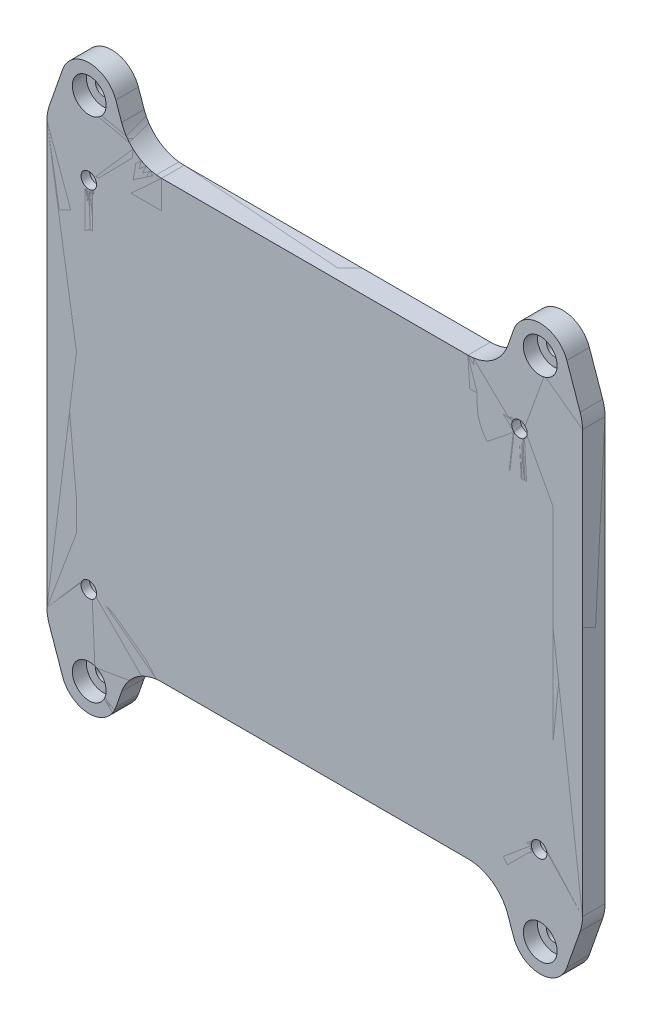
from build123d import *

# Parameters (mm, degrees)
PARTOFPLATESUPPORTINGCHARGER_SKETCH_W         = 190
PARTOFPLATESUPPORTINGCHARGER_SKETCH_H         = 154.72
PARTOFPLATESUPPORTINGCHARGER_EXTRUDE_DEPTH    = 8
PLATETOWALLMOUNTHOLETABSEED_EXTRUDE_DEPTH     = 8
MIRROR2_COPY_1_DEPTH                          = 8
FILLET2_R                                     = 15
PLATETOWALLMOUNTHOLES_SKETCH_R                = 2.75
PLATETOWALLMOUNTHOLESCLEARANCEHOLES_CUT_DEPTH = 139.162947276
PLATETOWALLMOUNTHOLESCOUNTERBORE_CUT_START    = 8
PLATETOWALLMOUNTHOLESCOUNTERBORE_SKETCH_R     = 6
PLATETOWALLMOUNTHOLESCOUNTERBORE_CUT_DEPTH    = 5
CHARGERTOPLATEHOLESCLEARANCEHOLES_SKETCH_R    = 2.75
CHARGERTOPLATEHOLES_CUT_DEPTH                 = 139.162947276
CHARGERTOPLATEHOLESCOUNTERBORES_SKETCH_R      = 6
CHARGERTOPLATEHOLESCOUNTERBORE_CUT_DEPTH      = 5
UNTHINNED_BODY_OUTLINE_R                      = 6
UNTHINNED_BODY_DEPTH                          = 8
UNTHINNED_BODY_2_OUTLINE_R                    = 6
UNTHINNED_BODY_2_OUTLINE_R_2                  = 2.75
UNTHINNED_BODY_2_DEPTH                        = 3
UNTHINNED_BODY_START                          = 5
UNTHINNED_BODY_3_OUTLINE_R                    = 6
UNTHINNED_BODY_3_OUTLINE_R_2                  = 2.75
UNTHINNED_BODY_3_DEPTH                        = 3
GUARANTEEDSOLIDREGIONS2AROUNDCHARGERTOPL_W    = 37.3625
GUARANTEEDSOLIDREGIONS2AROUNDCHARGERTOPL_H    = 28.505
BOSS_EXTRUDE5_DEPTH                           = 8
GUARANTEEDSOLIDREGIONS2AROUNDCHARGERTOPL_W_2  = 29.8525
BOSS_EXTRUDE5_2_DEPTH                         = 8
GUARANTEEDSOLIDREGIONS2AROUNDCHARGERTOPL_H_2  = 30.5
BOSS_EXTRUDE5_3_DEPTH                         = 8
GUARANTEEDSOLIDREGIONS2AROUNDCHARGERTOPL_W_3  = 30.3925
BOSS_EXTRUDE5_4_DEPTH                         = 8
CUT_EXTRUDE3_DEPTH                            = 8
NAIVETHINNABLEREGION_SKETCH_W                 = 169.09
NAIVETHINNABLEREGION_SKETCH_H                 = 134.72
NAIVETHINNABLEMASK_EXTRUDE_DEPTH              = 8
GUARANTEEDSOLIDREGIONS1AROUNDCHARGERTOPL_R    = 15
THINNABLEMASK_EXTRUDE_DEPTH                   = 8
THINNABLEMASKCOPY_DEPTH                       = 8
THINNINGPATTERNFODDER_SKETCH_R                = 150
THINNINGPATTERNFODDER_EXTRUDE_DEPTH           = 8
THINNINGPATTERN_DEPTH                         = 8
MOUNT_PLATE_EMPTY_INTERIOR_COPY_OUTLINE_R     = 6
MOUNT_PLATE_EMPTY_INTERIOR_COPY_DEPTH         = 8
MOUNT_PLATE_EMPTY_INTERIOR_COPY_2_OUTLIN_R    = 6
MOUNT_PLATE_EMPTY_INTERIOR_COPY_2_OUTLIN_R_2  = 2.75
MOUNT_PLATE_EMPTY_INTERIOR_COPY_2_DEPTH       = 3
MOUNT_PLATE_EMPTY_INTERIOR_COPY_START         = 5
MOUNT_PLATE_EMPTY_INTERIOR_COPY_3_OUTLIN_R    = 6
MOUNT_PLATE_EMPTY_INTERIOR_COPY_3_OUTLIN_R_2  = 2.75
MOUNT_PLATE_EMPTY_INTERIOR_COPY_3_DEPTH       = 3


# Read off the part's stored shape, not the designer's step: unthinned_body, thinnableMaskCopy, thinningPattern, mount_plate_empty_interior_copy
with BuildPart() as part:
    # partOfPlateSupportingCharger_sketch → partOfPlateSupportingCharger_extrude (new body)
    with BuildSketch(Plane.XY):
        Rectangle(PARTOFPLATESUPPORTINGCHARGER_SKETCH_W, PARTOFPLATESUPPORTINGCHARGER_SKETCH_H)
    extrude(amount=PARTOFPLATESUPPORTINGCHARGER_EXTRUDE_DEPTH)

    # plateToWallMountHoleTabSeed_sketch → plateToWallMountHoleTabSeed_extrude (add)
    with BuildSketch(Plane.XY):
        with BuildLine():
            Line((-89.442052821, 93.293575341), (-95, 77.36))
            Line((-95, 77.36), (-65, 77.36))
            Line((-65, 77.36), (-70.557947179, 93.293575341))
            ThreePointArc((-70.557947179, 93.293575341), (-80, 100), (-89.442052821, 93.293575341))
        make_face()
    platetowallmountholetabseed_extrude = extrude(amount=PLATETOWALLMOUNTHOLETABSEED_EXTRUDE_DEPTH)

    # Mirror1: plateToWallMountHoleTabSeed_extrude across plane
    add(platetowallmountholetabseed_extrude.mirror(Plane(origin=(0, 0, 0), x_dir=(0, 0, 1), z_dir=(1, 0, 0))))

    # Mirror2: plateToWallMountHoleTabSeed_extrude across plane
    add(platetowallmountholetabseed_extrude.mirror(Plane.ZX))

    # Mirror2 copy 1 sketch → Mirror2 copy 1 (add)
    with BuildSketch(Plane(origin=(0, 0, 0), x_dir=(-1, 0, 0), z_dir=(0, 0, 1))):
        with BuildLine():
            Line((-89.442052821, 93.293575341), (-95, 77.36))
            Line((-95, 77.36), (-65, 77.36))
            Line((-65, 77.36), (-70.557947179, 93.293575341))
            ThreePointArc((-70.557947179, 93.293575341), (-80, 100), (-89.442052821, 93.293575341))
        make_face()
    extrude(amount=MIRROR2_COPY_1_DEPTH)

    # Fillet2
    fillet2_edges = [part.edges().sort_by_distance(p)[0] for p in [
        (-65, 77.36, 4),
        (-95, 77.36, 4),
        (95, 77.36, 4),
        (95, -77.36, 4),
        (65, 77.36, 4),
        (-95, -77.36, 4),
        (65, -77.36, 4),
        (-65, -77.36, 4),
    ]]
    fillet(fillet2_edges, radius=FILLET2_R)

    # plateToWallMountHoles_sketch → plateToWallMountHolesClearanceHoles_cut (cut, through all)
    with BuildSketch(Plane.XY):
        with Locations((-80, 90)):
            Circle(PLATETOWALLMOUNTHOLES_SKETCH_R)
        with Locations((80, 90)):
            Circle(PLATETOWALLMOUNTHOLES_SKETCH_R)
        with Locations((80, -90)):
            Circle(PLATETOWALLMOUNTHOLES_SKETCH_R)
        with Locations((-80, -90)):
            Circle(PLATETOWALLMOUNTHOLES_SKETCH_R)
    extrude(amount=PLATETOWALLMOUNTHOLESCLEARANCEHOLES_CUT_DEPTH, mode=Mode.SUBTRACT)

    # plateToWallMountHolesCounterbore_sketch → plateToWallMountHolesCounterBore_cut (cut)
    with BuildSketch(Plane.XY.offset(PLATETOWALLMOUNTHOLESCOUNTERBORE_CUT_START)):
        with Locations((-80, 90)):
            Circle(PLATETOWALLMOUNTHOLESCOUNTERBORE_SKETCH_R)
        with Locations((80, 90)):
            Circle(PLATETOWALLMOUNTHOLESCOUNTERBORE_SKETCH_R)
        with Locations((80, -90)):
            Circle(PLATETOWALLMOUNTHOLESCOUNTERBORE_SKETCH_R)
        with Locations((-80, -90)):
            Circle(PLATETOWALLMOUNTHOLESCOUNTERBORE_SKETCH_R)
    extrude(amount=-PLATETOWALLMOUNTHOLESCOUNTERBORE_CUT_DEPTH, mode=Mode.SUBTRACT)

    # chargerToPlateHolesClearanceHoles_sketch → chargerToPlateHoles_cut (cut, through all)
    with BuildSketch(Plane.XY):
        with Locations((-80.1475, 63.855)):
            Circle(CHARGERTOPLATEHOLESCLEARANCEHOLES_SKETCH_R)
        with Locations((72.6375, 63.855)):
            Circle(CHARGERTOPLATEHOLESCLEARANCEHOLES_SKETCH_R)
        with Locations((-80.1475, -61.86)):
            Circle(CHARGERTOPLATEHOLESCLEARANCEHOLES_SKETCH_R)
        with Locations((79.6075, -61.86)):
            Circle(CHARGERTOPLATEHOLESCLEARANCEHOLES_SKETCH_R)
    extrude(amount=CHARGERTOPLATEHOLES_CUT_DEPTH, mode=Mode.SUBTRACT)

    # chargerToPlateHolesCounterbores_sketch → chargerToPlateHolesCounterbore_cut (cut)
    with BuildSketch(Plane.XY):
        with Locations((-80.1475, 63.855)):
            Circle(CHARGERTOPLATEHOLESCOUNTERBORES_SKETCH_R)
        with Locations((72.6375, 63.855)):
            Circle(CHARGERTOPLATEHOLESCOUNTERBORES_SKETCH_R)
        with Locations((-80.1475, -61.86)):
            Circle(CHARGERTOPLATEHOLESCOUNTERBORES_SKETCH_R)
        with Locations((79.6075, -61.86)):
            Circle(CHARGERTOPLATEHOLESCOUNTERBORES_SKETCH_R)
    extrude(amount=CHARGERTOPLATEHOLESCOUNTERBORE_CUT_DEPTH, mode=Mode.SUBTRACT)


with BuildPart() as body_2:
    # unthinned_body outline → unthinned_body (new body)
    with BuildSketch(Plane.XY):
        with BuildLine():
            ThreePointArc((-68.509000951, -87.419636988), (-63.031960944, -80.130824942), (-54.34592172, -77.36))
            Line((-54.34592172, -77.36), (54.34592172, -77.36))
            ThreePointArc((54.34592172, -77.36), (63.031960944, -80.130824942), (68.509000951, -87.419636988))
            Line((68.509000951, -87.419636988), (70.557947179, -93.293575341))
            ThreePointArc((70.557947179, -93.293575341), (80, -100), (89.442052821, -93.293575341))
            Line((89.442052821, -93.293575341), (94.163079231, -79.759292345))
            ThreePointArc((94.163079231, -79.759292345), (94.789289849, -77.324304708), (95, -74.818929334))
            Line((95, -74.818929334), (95, 74.818929334))
            ThreePointArc((95, 74.818929334), (94.789289849, 77.324304708), (94.163079231, 79.759292345))
            Line((94.163079231, 79.759292345), (89.442052821, 93.293575341))
            ThreePointArc((89.442052821, 93.293575341), (80, 100), (70.557947179, 93.293575341))
            Line((70.557947179, 93.293575341), (68.509000951, 87.419636988))
            ThreePointArc((68.509000951, 87.419636988), (63.031960944, 80.130824942), (54.34592172, 77.36))
            Line((54.34592172, 77.36), (-54.345921719, 77.36))
            ThreePointArc((-54.345921719, 77.36), (-63.031960944, 80.130824942), (-68.509000951, 87.419636988))
            Line((-68.509000951, 87.419636988), (-70.557947179, 93.293575341))
            ThreePointArc((-70.557947179, 93.293575341), (-80, 100), (-89.442052821, 93.293575341))
            Line((-89.442052821, 93.293575341), (-94.163079231, 79.759292345))
            ThreePointArc((-94.163079231, 79.759292345), (-94.789289849, 77.324304707), (-95, 74.818929333))
            Line((-95, 74.818929333), (-95, -74.818929333))
            ThreePointArc((-95, -74.818929333), (-94.789289849, -77.324304707), (-94.163079231, -79.759292345))
            Line((-94.163079231, -79.759292345), (-89.442052821, -93.293575341))
            ThreePointArc((-89.442052821, -93.293575341), (-80, -100), (-70.557947179, -93.293575341))
            Line((-70.557947179, -93.293575341), (-68.509000951, -87.419636988))
        make_face()
        with Locations((-80, -90)):
            Circle(UNTHINNED_BODY_OUTLINE_R, mode=Mode.SUBTRACT)
        with Locations((-80.1475, -61.86)):
            Circle(UNTHINNED_BODY_OUTLINE_R, mode=Mode.SUBTRACT)
        with Locations((80, -90)):
            Circle(UNTHINNED_BODY_OUTLINE_R, mode=Mode.SUBTRACT)
        with Locations((79.6075, -61.86)):
            Circle(UNTHINNED_BODY_OUTLINE_R, mode=Mode.SUBTRACT)
        with Locations((-80.1475, 63.855)):
            Circle(UNTHINNED_BODY_OUTLINE_R, mode=Mode.SUBTRACT)
        with Locations((-80, 90)):
            Circle(UNTHINNED_BODY_OUTLINE_R, mode=Mode.SUBTRACT)
        with Locations((72.6375, 63.855)):
            Circle(UNTHINNED_BODY_OUTLINE_R, mode=Mode.SUBTRACT)
        with Locations((80, 90)):
            Circle(UNTHINNED_BODY_OUTLINE_R, mode=Mode.SUBTRACT)
    extrude(amount=UNTHINNED_BODY_DEPTH)

    # unthinned_body 2 outline → unthinned_body 2 (add)
    # profile 1 of 4: a face of its own
    with BuildSketch(Plane.XY):
        with Locations((-80, -90)):
            Circle(UNTHINNED_BODY_2_OUTLINE_R)
        with Locations((-80, -90)):
            Circle(UNTHINNED_BODY_2_OUTLINE_R_2, mode=Mode.SUBTRACT)
    # profile 2 of 4: a face of its own
    with BuildSketch(Plane.XY):
        with Locations((80, -90)):
            Circle(UNTHINNED_BODY_2_OUTLINE_R)
        with Locations((80, -90)):
            Circle(UNTHINNED_BODY_2_OUTLINE_R_2, mode=Mode.SUBTRACT)
    # profile 3 of 4: a face of its own
    with BuildSketch(Plane.XY):
        with Locations((80, 90)):
            Circle(UNTHINNED_BODY_2_OUTLINE_R)
        with Locations((80, 90)):
            Circle(UNTHINNED_BODY_2_OUTLINE_R_2, mode=Mode.SUBTRACT)
    # profile 4 of 4: a face of its own
    with BuildSketch(Plane.XY):
        with Locations((-80, 90)):
            Circle(UNTHINNED_BODY_2_OUTLINE_R)
        with Locations((-80, 90)):
            Circle(UNTHINNED_BODY_2_OUTLINE_R_2, mode=Mode.SUBTRACT)
    extrude(amount=UNTHINNED_BODY_2_DEPTH)

    # unthinned_body 3 outline → unthinned_body 3 (add)
    # profile 1 of 4: a face of its own
    with BuildSketch(Plane.XY.offset(UNTHINNED_BODY_START)):
        with Locations((79.6075, -61.86)):
            Circle(UNTHINNED_BODY_3_OUTLINE_R)
        with Locations((79.6075, -61.86)):
            Circle(UNTHINNED_BODY_3_OUTLINE_R_2, mode=Mode.SUBTRACT)
    # profile 2 of 4: a face of its own
    with BuildSketch(Plane.XY.offset(UNTHINNED_BODY_START)):
        with Locations((-80.1475, -61.86)):
            Circle(UNTHINNED_BODY_3_OUTLINE_R)
        with Locations((-80.1475, -61.86)):
            Circle(UNTHINNED_BODY_3_OUTLINE_R_2, mode=Mode.SUBTRACT)
    # profile 3 of 4: a face of its own
    with BuildSketch(Plane.XY.offset(UNTHINNED_BODY_START)):
        with Locations((72.6375, 63.855)):
            Circle(UNTHINNED_BODY_3_OUTLINE_R)
        with Locations((72.6375, 63.855)):
            Circle(UNTHINNED_BODY_3_OUTLINE_R_2, mode=Mode.SUBTRACT)
    # profile 4 of 4: a face of its own
    with BuildSketch(Plane.XY.offset(UNTHINNED_BODY_START)):
        with Locations((-80.1475, 63.855)):
            Circle(UNTHINNED_BODY_3_OUTLINE_R)
        with Locations((-80.1475, 63.855)):
            Circle(UNTHINNED_BODY_3_OUTLINE_R_2, mode=Mode.SUBTRACT)
    extrude(amount=UNTHINNED_BODY_3_DEPTH)


with BuildPart() as body_3:
    # guaranteedSolidRegions2AroundChargerToPlateMountHoles_sketch → Boss-Extrude5 (new body)
    with BuildSketch(Plane.XY):
        with Locations((76.31875, 63.1075)):
            Rectangle(GUARANTEEDSOLIDREGIONS2AROUNDCHARGERTOPL_W, GUARANTEEDSOLIDREGIONS2AROUNDCHARGERTOPL_H)
    extrude(amount=BOSS_EXTRUDE5_DEPTH)


with BuildPart() as body_4:
    # guaranteedSolidRegions2AroundChargerToPlateMountHoles_sketch → Boss-Extrude5 2 (new body)
    with BuildSketch(Plane.XY):
        with Locations((-80.07375, 63.1075)):
            Rectangle(GUARANTEEDSOLIDREGIONS2AROUNDCHARGERTOPL_W_2, GUARANTEEDSOLIDREGIONS2AROUNDCHARGERTOPL_H)
    extrude(amount=BOSS_EXTRUDE5_2_DEPTH)


with BuildPart() as body_5:
    # guaranteedSolidRegions2AroundChargerToPlateMountHoles_sketch → Boss-Extrude5 3 (new body)
    with BuildSketch(Plane.XY):
        with Locations((-80.07375, -62.11)):
            Rectangle(GUARANTEEDSOLIDREGIONS2AROUNDCHARGERTOPL_W_2, GUARANTEEDSOLIDREGIONS2AROUNDCHARGERTOPL_H_2)
    extrude(amount=BOSS_EXTRUDE5_3_DEPTH)


with BuildPart() as body_6:
    # guaranteedSolidRegions2AroundChargerToPlateMountHoles_sketch → Boss-Extrude5 4 (new body)
    with BuildSketch(Plane.XY):
        with Locations((79.80375, -62.11)):
            Rectangle(GUARANTEEDSOLIDREGIONS2AROUNDCHARGERTOPL_W_3, GUARANTEEDSOLIDREGIONS2AROUNDCHARGERTOPL_H_2)
    extrude(amount=BOSS_EXTRUDE5_4_DEPTH)


with BuildPart() as cut_extrude3_tool:
    # Sketch11 → Cut-Extrude3 (new body)
    with BuildSketch(Plane.XY):
        Polygon((-80.1475, 63.855), (72.6375, 63.855), (79.6075, -61.86), (-80.1475, -61.86), align=None)
    extrude(amount=CUT_EXTRUDE3_DEPTH)


with BuildPart() as body_4_1:
    add(body_4.part)

    # Cut-Extrude3: cut by cut_extrude3_tool
    add(cut_extrude3_tool.part, mode=Mode.SUBTRACT)


with BuildPart() as body_3_1:
    add(body_3.part)

    # Cut-Extrude3: cut by cut_extrude3_tool
    add(cut_extrude3_tool.part, mode=Mode.SUBTRACT)


with BuildPart() as body_6_1:
    add(body_6.part)

    # Cut-Extrude3: cut by cut_extrude3_tool
    add(cut_extrude3_tool.part, mode=Mode.SUBTRACT)


with BuildPart() as body_5_1:
    add(body_5.part)

    # Cut-Extrude3: cut by cut_extrude3_tool
    add(cut_extrude3_tool.part, mode=Mode.SUBTRACT)


with BuildPart() as body_7:
    # naiveThinnableRegion_sketch → naiveThinnableMask_extrude (new body)
    with BuildSketch(Plane.XY):
        Rectangle(NAIVETHINNABLEREGION_SKETCH_W, NAIVETHINNABLEREGION_SKETCH_H)
    extrude(amount=NAIVETHINNABLEMASK_EXTRUDE_DEPTH)

    # Combine4: cut body 4, body 5, body 6, body 3
    add(body_4_1.part, mode=Mode.SUBTRACT)
    add(body_5_1.part, mode=Mode.SUBTRACT)
    add(body_6_1.part, mode=Mode.SUBTRACT)
    add(body_3_1.part, mode=Mode.SUBTRACT)

    # guaranteedSolidRegions1AroundChargerToPlateMountHoles_sketch → thinnableMask_extrude (cut)
    with BuildSketch(Plane.XY):
        with Locations((-80.1475, 63.855)):
            Circle(GUARANTEEDSOLIDREGIONS1AROUNDCHARGERTOPL_R)
        with Locations((72.6375, 63.855)):
            Circle(GUARANTEEDSOLIDREGIONS1AROUNDCHARGERTOPL_R)
        with Locations((-80.1475, -61.86)):
            Circle(GUARANTEEDSOLIDREGIONS1AROUNDCHARGERTOPL_R)
        with Locations((79.6075, -61.86)):
            Circle(GUARANTEEDSOLIDREGIONS1AROUNDCHARGERTOPL_R)
    extrude(amount=THINNABLEMASK_EXTRUDE_DEPTH, mode=Mode.SUBTRACT)


with BuildPart() as body_4_2:
    # thinnableMaskCopy outline → thinnableMaskCopy (new body)
    with BuildSketch(Plane.XY):
        with BuildLine():
            Line((84.545, 48.855), (73.469143002, 48.855))
            Line((73.469143002, 48.855), (73.467867743, 48.878001322))
            ThreePointArc((73.467867743, 48.878001322), (62.3286571, 52.958773219), (57.6375, 63.855))
            Line((57.6375, 63.855), (57.6375, 67.36))
            Line((57.6375, 67.36), (-65.1475, 67.36))
            Line((-65.1475, 67.36), (-65.1475, 63.855))
            ThreePointArc((-65.1475, 63.855), (-69.540898282, 53.248398282), (-80.1475, 48.855))
            Line((-80.1475, 48.855), (-84.545, 48.855))
            Line((-84.545, 48.855), (-84.545, -46.86))
            Line((-84.545, -46.86), (-80.1475, -46.86))
            ThreePointArc((-80.1475, -46.86), (-69.540898282, -51.253398282), (-65.1475, -61.86))
            Line((-65.1475, -61.86), (-65.1475, -67.36))
            Line((-65.1475, -67.36), (64.6075, -67.36))
            Line((64.6075, -67.36), (64.6075, -61.86))
            ThreePointArc((64.6075, -61.86), (68.711273219, -51.551157101), (78.777132257, -46.883001322))
            Line((78.777132257, -46.883001322), (78.775856998, -46.86))
            Line((78.775856998, -46.86), (84.545, -46.86))
            Line((84.545, -46.86), (84.545, 48.855))
        make_face()
    extrude(amount=THINNABLEMASKCOPY_DEPTH)


with BuildPart() as body_5_2:
    # thinningPatternFodder_sketch → thinningPatternFodder_extrude (new body)
    with BuildSketch(Plane.XY):
        Circle(THINNINGPATTERNFODDER_SKETCH_R)
    extrude(amount=THINNINGPATTERNFODDER_EXTRUDE_DEPTH)

    # thinningPattern outline → thinningPattern (cut)
    with BuildSketch(Plane.XY):
        Polygon((-122.5, -47.631397208), (-107.5, -38.97114317), (-107.5, -21.650635095), (-122.5, -12.990381057), (-137.5, -21.650635095), (-137.5, -38.97114317), align=None)
        Polygon((87.5, 73.612159322), (102.5, 82.27241336), (102.5, 99.592921435), (87.5, 108.253175473), (72.5, 99.592921435), (72.5, 82.27241336), align=None)
        Polygon((-70, -17.320508076), (-55, -8.660254038), (-55, 8.660254038), (-70, 17.320508076), (-85, 8.660254038), (-85, -8.660254038), align=None)
        Polygon((35, 43.301270189), (50, 51.961524227), (50, 69.282032303), (35, 77.942286341), (20, 69.282032303), (20, 51.961524227), align=None)
        Polygon((-17.5, 12.990381057), (-2.5, 21.650635095), (-2.5, 38.97114317), (-17.5, 47.631397208), (-32.5, 38.97114317), (-32.5, 21.650635095), align=None)
        Polygon((-32.5, -99.592921435), (-17.5, -108.253175473), (-2.5, -99.592921435), (-2.5, -82.27241336), (-17.5, -73.612159322), (-32.5, -82.27241336), align=None)
        Polygon((20, -129.903810568), (35, -138.564064606), (50, -129.903810568), (50, -112.583302492), (35, -103.923048454), (20, -112.583302492), align=None)
        Polygon((-85, -69.282032303), (-70, -77.942286341), (-55, -69.282032303), (-55, -51.961524227), (-70, -43.301270189), (-85, -51.961524227), align=None)
        Polygon((-137.5, 38.97114317), (-137.5, 21.650635095), (-122.5, 12.990381057), (-107.5, 21.650635095), (-107.5, 38.97114317), (-122.5, 47.631397208), align=None)
        Polygon((35, -77.942286341), (50, -69.282032303), (50, -51.961524227), (35, -43.301270189), (20, -51.961524227), (20, -69.282032303), align=None)
        Polygon((87.5, -47.631397208), (102.5, -38.97114317), (102.5, -21.650635095), (87.5, -12.990381057), (72.5, -21.650635095), (72.5, -38.97114317), align=None)
        Polygon((-32.5, -38.97114317), (-17.5, -47.631397208), (-2.5, -38.97114317), (-2.5, -21.650635095), (-17.5, -12.990381057), (-32.5, -21.650635095), align=None)
        Polygon((72.5, -99.592921435), (87.5, -108.253175473), (102.5, -99.592921435), (102.5, -82.27241336), (87.5, -73.612159322), (72.5, -82.27241336), align=None)
        Polygon((20, 8.660254038), (20, -8.660254038), (35, -17.320508076), (50, -8.660254038), (50, 8.660254038), (35, 17.320508076), align=None)
        Polygon((20, 129.903810568), (20, 112.583302492), (35, 103.923048454), (50, 112.583302492), (50, 129.903810568), (35, 138.564064606), align=None)
        Polygon((0, -77.942286341), (15, -69.282032303), (15, -51.961524227), (0, -43.301270189), (-15, -51.961524227), (-15, -69.282032303), align=None)
        Polygon((52.5, -47.631397208), (67.5, -38.97114317), (67.5, -21.650635095), (52.5, -12.990381057), (37.5, -21.650635095), (37.5, -38.97114317), align=None)
        Polygon((-52.5, -108.253175473), (-37.5, -99.592921435), (-37.5, -82.27241336), (-52.5, -73.612159322), (-67.5, -82.27241336), (-67.5, -99.592921435), align=None)
        Polygon((105, -17.320508076), (120, -8.660254038), (120, 8.660254038), (105, 17.320508076), (90, 8.660254038), (90, -8.660254038), align=None)
        Polygon((37.5, -99.592921435), (52.5, -108.253175473), (67.5, -99.592921435), (67.5, -82.27241336), (52.5, -73.612159322), (37.5, -82.27241336), align=None)
        Polygon((-120, -8.660254038), (-105, -17.320508076), (-90, -8.660254038), (-90, 8.660254038), (-105, 17.320508076), (-120, 8.660254038), align=None)
        Polygon((-67.5, -38.97114317), (-52.5, -47.631397208), (-37.5, -38.97114317), (-37.5, -21.650635095), (-52.5, -12.990381057), (-67.5, -21.650635095), align=None)
        Polygon((-15, -112.583302492), (-15, -129.903810568), (0, -138.564064606), (15, -129.903810568), (15, -112.583302492), (0, -103.923048454), align=None)
        Polygon((-15, 129.903810568), (-15, 112.583302492), (0, 103.923048454), (15, 112.583302492), (15, 129.903810568), (0, 138.564064606), align=None)
        Polygon((-15, 8.660254038), (-15, -8.660254038), (0, -17.320508076), (15, -8.660254038), (15, 8.660254038), (0, 17.320508076), align=None)
        Polygon((-15, 69.282032303), (-15, 51.961524227), (0, 43.301270189), (15, 51.961524227), (15, 69.282032303), (0, 77.942286341), align=None)
        Polygon((-35, -138.564064606), (-20, -129.903810568), (-20, -112.583302492), (-35, -103.923048454), (-50, -112.583302492), (-50, -129.903810568), align=None)
        Polygon((122.5, -47.631397208), (137.5, -38.97114317), (137.5, -21.650635095), (122.5, -12.990381057), (107.5, -21.650635095), (107.5, -38.97114317), align=None)
        Polygon((17.5, -108.253175473), (32.5, -99.592921435), (32.5, -82.27241336), (17.5, -73.612159322), (2.5, -82.27241336), (2.5, -99.592921435), align=None)
        Polygon((70, -77.942286341), (85, -69.282032303), (85, -51.961524227), (70, -43.301270189), (55, -51.961524227), (55, -69.282032303), align=None)
        Polygon((-102.5, -99.592921435), (-87.5, -108.253175473), (-72.5, -99.592921435), (-72.5, -82.27241336), (-87.5, -73.612159322), (-102.5, -82.27241336), align=None)
        Polygon((-50, -51.961524227), (-50, -69.282032303), (-35, -77.942286341), (-20, -69.282032303), (-20, -51.961524227), (-35, -43.301270189), align=None)
        Polygon((-50, 69.282032303), (-50, 51.961524227), (-35, 43.301270189), (-20, 51.961524227), (-20, 69.282032303), (-35, 77.942286341), align=None)
        Polygon((-50, 129.903810568), (-50, 112.583302492), (-35, 103.923048454), (-20, 112.583302492), (-20, 129.903810568), (-35, 138.564064606), align=None)
        Polygon((-50, 8.660254038), (-50, -8.660254038), (-35, -17.320508076), (-20, -8.660254038), (-20, 8.660254038), (-35, 17.320508076), align=None)
        Polygon((-32.5, 99.592921435), (-32.5, 82.27241336), (-17.5, 73.612159322), (-2.5, 82.27241336), (-2.5, 99.592921435), (-17.5, 108.253175473), align=None)
        Polygon((105, -77.942286341), (120, -69.282032303), (120, -51.961524227), (105, -43.301270189), (90, -51.961524227), (90, -69.282032303), align=None)
        Polygon((-120, -69.282032303), (-105, -77.942286341), (-90, -69.282032303), (-90, -51.961524227), (-105, -43.301270189), (-120, -51.961524227), align=None)
        Polygon((55, -8.660254038), (70, -17.320508076), (85, -8.660254038), (85, 8.660254038), (70, 17.320508076), (55, 8.660254038), align=None)
        Polygon((-102.5, 82.27241336), (-87.5, 73.612159322), (-72.5, 82.27241336), (-72.5, 99.592921435), (-87.5, 108.253175473), (-102.5, 99.592921435), align=None)
        Polygon((2.5, 21.650635095), (17.5, 12.990381057), (32.5, 21.650635095), (32.5, 38.97114317), (17.5, 47.631397208), (2.5, 38.97114317), align=None)
        Polygon((107.5, 38.97114317), (107.5, 21.650635095), (122.5, 12.990381057), (137.5, 21.650635095), (137.5, 38.97114317), (122.5, 47.631397208), align=None)
        Polygon((-85, 51.961524227), (-70, 43.301270189), (-55, 51.961524227), (-55, 69.282032303), (-70, 77.942286341), (-85, 69.282032303), align=None)
        Polygon((72.5, 38.97114317), (72.5, 21.650635095), (87.5, 12.990381057), (102.5, 21.650635095), (102.5, 38.97114317), (87.5, 47.631397208), align=None)
        Polygon((-120, 51.961524227), (-105, 43.301270189), (-90, 51.961524227), (-90, 69.282032303), (-105, 77.942286341), (-120, 69.282032303), align=None)
        Polygon((-67.5, 21.650635095), (-52.5, 12.990381057), (-37.5, 21.650635095), (-37.5, 38.97114317), (-52.5, 47.631397208), (-67.5, 38.97114317), align=None)
        Polygon((37.5, 99.592921435), (37.5, 82.27241336), (52.5, 73.612159322), (67.5, 82.27241336), (67.5, 99.592921435), (52.5, 108.253175473), align=None)
        Polygon((37.5, 38.97114317), (37.5, 21.650635095), (52.5, 12.990381057), (67.5, 21.650635095), (67.5, 38.97114317), (52.5, 47.631397208), align=None)
        Polygon((17.5, -47.631397208), (32.5, -38.97114317), (32.5, -21.650635095), (17.5, -12.990381057), (2.5, -21.650635095), (2.5, -38.97114317), align=None)
        Polygon((-102.5, -38.97114317), (-87.5, -47.631397208), (-72.5, -38.97114317), (-72.5, -21.650635095), (-87.5, -12.990381057), (-102.5, -21.650635095), align=None)
        Polygon((-67.5, 99.592921435), (-67.5, 82.27241336), (-52.5, 73.612159322), (-37.5, 82.27241336), (-37.5, 99.592921435), (-52.5, 108.253175473), align=None)
        Polygon((-102.5, 21.650635095), (-87.5, 12.990381057), (-72.5, 21.650635095), (-72.5, 38.97114317), (-87.5, 47.631397208), (-102.5, 38.97114317), align=None)
        Polygon((2.5, 99.592921435), (2.5, 82.27241336), (17.5, 73.612159322), (32.5, 82.27241336), (32.5, 99.592921435), (17.5, 108.253175473), align=None)
        Polygon((55, 69.282032303), (55, 51.961524227), (70, 43.301270189), (85, 51.961524227), (85, 69.282032303), (70, 77.942286341), align=None)
        Polygon((90, 69.282032303), (90, 51.961524227), (105, 43.301270189), (120, 51.961524227), (120, 69.282032303), (105, 77.942286341), align=None)
    extrude(amount=THINNINGPATTERN_DEPTH, mode=Mode.SUBTRACT)

    # thinnedRegion_combine: intersect body 7
    add(body_7.part, mode=Mode.INTERSECT)


with BuildPart() as part_1:
    add(part.part)

    # mount_plate_empty_interior_subtract: cut body 4 2
    add(body_4_2.part, mode=Mode.SUBTRACT)


with BuildPart() as body_4_3:
    # mount_plate_empty_interior_copy outline → mount_plate_empty_interior_copy (new body)
    with BuildSketch(Plane.XY):
        with BuildLine():
            ThreePointArc((-68.509000951, -87.419636988), (-63.031960944, -80.130824942), (-54.34592172, -77.36))
            Line((-54.34592172, -77.36), (54.34592172, -77.36))
            ThreePointArc((54.34592172, -77.36), (63.031960944, -80.130824942), (68.509000951, -87.419636988))
            Line((68.509000951, -87.419636988), (70.557947179, -93.293575341))
            ThreePointArc((70.557947179, -93.293575341), (80, -100), (89.442052821, -93.293575341))
            Line((89.442052821, -93.293575341), (94.163079231, -79.759292345))
            ThreePointArc((94.163079231, -79.759292345), (94.789289849, -77.324304708), (95, -74.818929334))
            Line((95, -74.818929334), (95, 74.818929334))
            ThreePointArc((95, 74.818929334), (94.789289849, 77.324304708), (94.163079231, 79.759292345))
            Line((94.163079231, 79.759292345), (89.442052821, 93.293575341))
            ThreePointArc((89.442052821, 93.293575341), (80, 100), (70.557947179, 93.293575341))
            Line((70.557947179, 93.293575341), (68.509000951, 87.419636988))
            ThreePointArc((68.509000951, 87.419636988), (63.031960944, 80.130824942), (54.34592172, 77.36))
            Line((54.34592172, 77.36), (-54.345921719, 77.36))
            ThreePointArc((-54.345921719, 77.36), (-63.031960944, 80.130824942), (-68.509000951, 87.419636988))
            Line((-68.509000951, 87.419636988), (-70.557947179, 93.293575341))
            ThreePointArc((-70.557947179, 93.293575341), (-80, 100), (-89.442052821, 93.293575341))
            Line((-89.442052821, 93.293575341), (-94.163079231, 79.759292345))
            ThreePointArc((-94.163079231, 79.759292345), (-94.789289849, 77.324304707), (-95, 74.818929333))
            Line((-95, 74.818929333), (-95, -74.818929333))
            ThreePointArc((-95, -74.818929333), (-94.789289849, -77.324304707), (-94.163079231, -79.759292345))
            Line((-94.163079231, -79.759292345), (-89.442052821, -93.293575341))
            ThreePointArc((-89.442052821, -93.293575341), (-80, -100), (-70.557947179, -93.293575341))
            Line((-70.557947179, -93.293575341), (-68.509000951, -87.419636988))
        make_face()
        with Locations((-80, -90)):
            Circle(MOUNT_PLATE_EMPTY_INTERIOR_COPY_OUTLINE_R, mode=Mode.SUBTRACT)
        with Locations((-80.1475, -61.86)):
            Circle(MOUNT_PLATE_EMPTY_INTERIOR_COPY_OUTLINE_R, mode=Mode.SUBTRACT)
        with Locations((80, -90)):
            Circle(MOUNT_PLATE_EMPTY_INTERIOR_COPY_OUTLINE_R, mode=Mode.SUBTRACT)
        with Locations((79.6075, -61.86)):
            Circle(MOUNT_PLATE_EMPTY_INTERIOR_COPY_OUTLINE_R, mode=Mode.SUBTRACT)
        with Locations((-80.1475, 63.855)):
            Circle(MOUNT_PLATE_EMPTY_INTERIOR_COPY_OUTLINE_R, mode=Mode.SUBTRACT)
        with Locations((-80, 90)):
            Circle(MOUNT_PLATE_EMPTY_INTERIOR_COPY_OUTLINE_R, mode=Mode.SUBTRACT)
        with BuildLine():
            Line((73.467867743, 48.878001322), (73.469143002, 48.855))
            Line((73.469143002, 48.855), (84.545, 48.855))
            Line((84.545, 48.855), (84.545, -46.86))
            Line((84.545, -46.86), (78.775856998, -46.86))
            Line((78.775856998, -46.86), (78.777132257, -46.883001322))
            ThreePointArc((78.777132257, -46.883001322), (68.711273219, -51.551157101), (64.6075, -61.86))
            Line((64.6075, -61.86), (64.6075, -67.36))
            Line((64.6075, -67.36), (-65.1475, -67.36))
            Line((-65.1475, -67.36), (-65.1475, -61.86))
            ThreePointArc((-65.1475, -61.86), (-69.540898282, -51.253398282), (-80.1475, -46.86))
            Line((-80.1475, -46.86), (-84.545, -46.86))
            Line((-84.545, -46.86), (-84.545, 48.855))
            Line((-84.545, 48.855), (-80.1475, 48.855))
            ThreePointArc((-80.1475, 48.855), (-69.540898282, 53.248398282), (-65.1475, 63.855))
            Line((-65.1475, 63.855), (-65.1475, 67.36))
            Line((-65.1475, 67.36), (57.6375, 67.36))
            Line((57.6375, 67.36), (57.6375, 63.855))
            ThreePointArc((57.6375, 63.855), (62.3286571, 52.958773219), (73.467867743, 48.878001322))
        make_face(mode=Mode.SUBTRACT)
        with Locations((72.6375, 63.855)):
            Circle(MOUNT_PLATE_EMPTY_INTERIOR_COPY_OUTLINE_R, mode=Mode.SUBTRACT)
        with Locations((80, 90)):
            Circle(MOUNT_PLATE_EMPTY_INTERIOR_COPY_OUTLINE_R, mode=Mode.SUBTRACT)
    extrude(amount=MOUNT_PLATE_EMPTY_INTERIOR_COPY_DEPTH)

    # mount_plate_empty_interior_copy 2 outlin → mount_plate_empty_interior_copy 2 (add)
    # profile 1 of 4: a face of its own
    with BuildSketch(Plane.XY):
        with Locations((-80, -90)):
            Circle(MOUNT_PLATE_EMPTY_INTERIOR_COPY_2_OUTLIN_R)
        with Locations((-80, -90)):
            Circle(MOUNT_PLATE_EMPTY_INTERIOR_COPY_2_OUTLIN_R_2, mode=Mode.SUBTRACT)
    # profile 2 of 4: a face of its own
    with BuildSketch(Plane.XY):
        with Locations((80, -90)):
            Circle(MOUNT_PLATE_EMPTY_INTERIOR_COPY_2_OUTLIN_R)
        with Locations((80, -90)):
            Circle(MOUNT_PLATE_EMPTY_INTERIOR_COPY_2_OUTLIN_R_2, mode=Mode.SUBTRACT)
    # profile 3 of 4: a face of its own
    with BuildSketch(Plane.XY):
        with Locations((80, 90)):
            Circle(MOUNT_PLATE_EMPTY_INTERIOR_COPY_2_OUTLIN_R)
        with Locations((80, 90)):
            Circle(MOUNT_PLATE_EMPTY_INTERIOR_COPY_2_OUTLIN_R_2, mode=Mode.SUBTRACT)
    # profile 4 of 4: a face of its own
    with BuildSketch(Plane.XY):
        with Locations((-80, 90)):
            Circle(MOUNT_PLATE_EMPTY_INTERIOR_COPY_2_OUTLIN_R)
        with Locations((-80, 90)):
            Circle(MOUNT_PLATE_EMPTY_INTERIOR_COPY_2_OUTLIN_R_2, mode=Mode.SUBTRACT)
    extrude(amount=MOUNT_PLATE_EMPTY_INTERIOR_COPY_2_DEPTH)

    # mount_plate_empty_interior_copy 3 outlin → mount_plate_empty_interior_copy 3 (add)
    # profile 1 of 4: a face of its own
    with BuildSketch(Plane.XY.offset(MOUNT_PLATE_EMPTY_INTERIOR_COPY_START)):
        with Locations((79.6075, -61.86)):
            Circle(MOUNT_PLATE_EMPTY_INTERIOR_COPY_3_OUTLIN_R)
        with Locations((79.6075, -61.86)):
            Circle(MOUNT_PLATE_EMPTY_INTERIOR_COPY_3_OUTLIN_R_2, mode=Mode.SUBTRACT)
    # profile 2 of 4: a face of its own
    with BuildSketch(Plane.XY.offset(MOUNT_PLATE_EMPTY_INTERIOR_COPY_START)):
        with Locations((-80.1475, -61.86)):
            Circle(MOUNT_PLATE_EMPTY_INTERIOR_COPY_3_OUTLIN_R)
        with Locations((-80.1475, -61.86)):
            Circle(MOUNT_PLATE_EMPTY_INTERIOR_COPY_3_OUTLIN_R_2, mode=Mode.SUBTRACT)
    # profile 3 of 4: a face of its own
    with BuildSketch(Plane.XY.offset(MOUNT_PLATE_EMPTY_INTERIOR_COPY_START)):
        with Locations((72.6375, 63.855)):
            Circle(MOUNT_PLATE_EMPTY_INTERIOR_COPY_3_OUTLIN_R)
        with Locations((72.6375, 63.855)):
            Circle(MOUNT_PLATE_EMPTY_INTERIOR_COPY_3_OUTLIN_R_2, mode=Mode.SUBTRACT)
    # profile 4 of 4: a face of its own
    with BuildSketch(Plane.XY.offset(MOUNT_PLATE_EMPTY_INTERIOR_COPY_START)):
        with Locations((-80.1475, 63.855)):
            Circle(MOUNT_PLATE_EMPTY_INTERIOR_COPY_3_OUTLIN_R)
        with Locations((-80.1475, 63.855)):
            Circle(MOUNT_PLATE_EMPTY_INTERIOR_COPY_3_OUTLIN_R_2, mode=Mode.SUBTRACT)
    extrude(amount=MOUNT_PLATE_EMPTY_INTERIOR_COPY_3_DEPTH)


with BuildPart() as body_5_2_1:
    add(body_5_2.part)

    # mount_plate_thinned_interior_combine: union body 4 3
    add(body_4_3.part)


solid = Compound([body_2.part, part_1.part, body_5_2_1.part])
